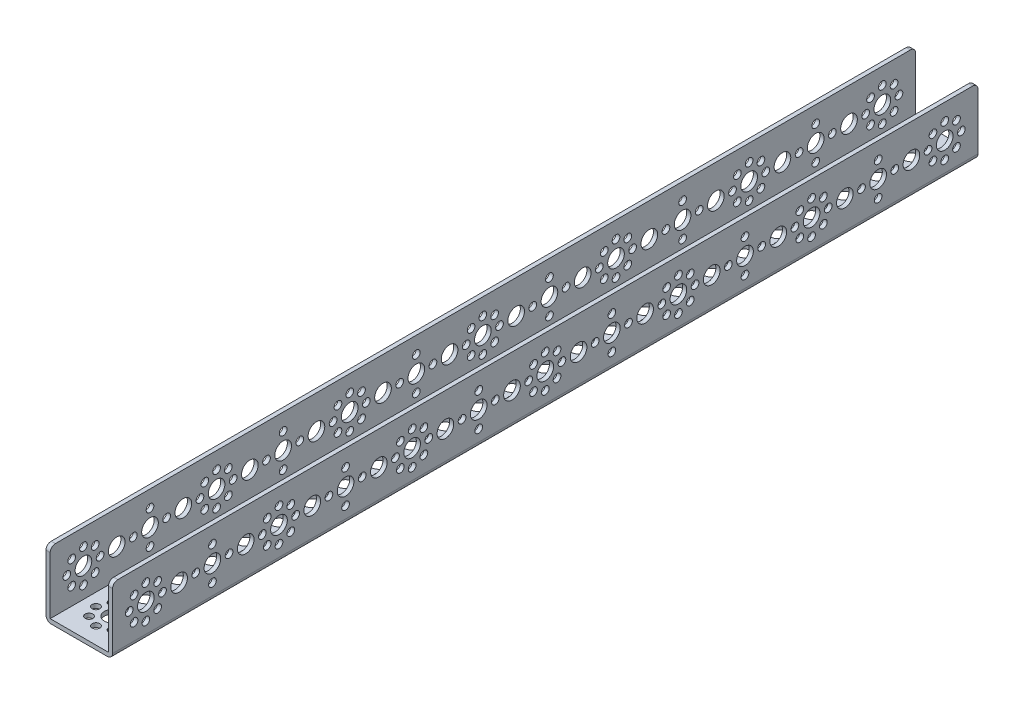
from build123d import *

# Parameters (mm, degrees)
SKETCH1_W                      = 32
SKETCH1_H                      = 416
BOSS_EXTRUDE1_DEPTH            = 32
SKETCH2_W                      = 28
SKETCH2_H                      = 30
CUT_EXTRUDE1_DEPTH             = 418.535627222
F_8_0_8_DIAMETER_HOLE1_D       = 8
F_8_0_8_DIAMETER_HOLE1_DEPTH   = 2
F_8_0_8_DIAMETER_HOLE2_D       = 8
F_8_0_8_DIAMETER_HOLE2_DEPTH   = 2
F_3_7_3_7_DIAMETER_HOLE1_D     = 3.7
F_3_7_3_7_DIAMETER_HOLE1_DEPTH = 2
F_3_7_3_7_DIAMETER_HOLE2_D     = 3.7
F_3_7_3_7_DIAMETER_HOLE2_DEPTH = 32
F_8_0_8_DIAMETER_HOLE3_D       = 8
F_8_0_8_DIAMETER_HOLE3_DEPTH   = 32
F_8_0_8_DIAMETER_HOLE4_D       = 8
F_8_0_8_DIAMETER_HOLE4_DEPTH   = 32
F_3_7_3_7_DIAMETER_HOLE3_D     = 3.7
F_3_7_3_7_DIAMETER_HOLE3_DEPTH = 32
FILLET1_R                      = 2.5


with BuildPart() as part:
    # Sketch1 → Boss-Extrude1 (new body)
    with BuildSketch(Plane(origin=(-16, 0, 0), x_dir=(0, -1, 0), z_dir=(-1, 0, 0))):
        with Locations((-16, -192)):
            Rectangle(SKETCH1_W, SKETCH1_H)
    extrude(amount=-BOSS_EXTRUDE1_DEPTH)

    # Sketch2 → Cut-Extrude1 (cut, through all)
    with BuildSketch(Plane.XY.offset(16)):
        with Locations((0, 17)):
            Rectangle(SKETCH2_W, SKETCH2_H)
    extrude(amount=-CUT_EXTRUDE1_DEPTH, mode=Mode.SUBTRACT)

    # Ø8.0 (8) Diameter Hole1
    with Locations(Plane.ZY.offset(-14)):
        with Locations((-32, 16)):
            Hole(F_8_0_8_DIAMETER_HOLE1_D / 2, depth=F_8_0_8_DIAMETER_HOLE1_DEPTH)

    # Ø8.0 (8) Diameter Hole2
    with Locations(Plane(origin=(16, 0, 0), x_dir=(0, 0, -1), z_dir=(1, 0, 0))):
        with Locations((64, 16), (128, 16), (192, 16), (256, 16), (320, 16), (384, 16), (96, 16), (160, 16), (224, 16), (288, 16), (352, 16), (16, 16), (48, 16), (80, 16), (112, 16), (144, 16), (176, 16), (208, 16), (240, 16), (0, 16), (272, 16), (304, 16), (336, 16), (368, 16)):
            Hole(F_8_0_8_DIAMETER_HOLE2_D / 2, depth=F_8_0_8_DIAMETER_HOLE2_DEPTH)

    # Ø3.7 (3.7) Diameter Hole1
    with Locations(Plane(origin=(16, 0, 0), x_dir=(0, 0, -1), z_dir=(1, 0, 0))):
        with Locations((0, 24), (0, 8), (8, 16), (-8, 16), (5.656854249, 21.656854249), (-5.656854249, 21.656854249), (-5.656854249, 10.343145751), (5.656854249, 10.343145751), (64, 24), (64, 8), (72, 16), (56, 16), (69.656854249, 21.656854249), (58.343145751, 21.656854249), (58.343145751, 10.343145751), (69.656854249, 10.343145751), (128, 24), (128, 8), (136, 16), (120, 16), (133.656854249, 21.656854249), (122.34314575, 21.656854249), (122.34314575, 10.343145751), (133.656854249, 10.343145751), (192, 24), (192, 8), (200, 16), (184, 16), (197.656854249, 21.656854249), (186.343145751, 21.656854249), (186.343145751, 10.343145751), (197.656854249, 10.343145751), (256, 24), (256, 8), (264, 16), (248, 16), (261.656854249, 21.656854249), (250.343145751, 21.656854249), (250.343145751, 10.343145751), (261.656854249, 10.343145751), (320, 24), (320, 8), (328, 16), (312, 16), (325.656854249, 21.656854249), (314.343145751, 21.656854249), (314.343145751, 10.343145751), (325.656854249, 10.343145751), (384, 24), (384, 8), (392, 16), (376, 16), (389.656854249, 21.656854249), (378.343145751, 21.656854249), (378.343145751, 10.343145751), (389.656854249, 10.343145751), (32, 24), (40, 16), (32, 8), (24, 16), (96, 24), (104, 16), (96, 8), (88, 16), (160, 24), (168, 16), (160, 8), (152, 16), (224, 24), (232, 16), (224, 8), (216, 16), (288, 24), (296, 16), (288, 8), (280, 16), (352, 24), (360, 16), (352, 8), (344, 16)):
            Hole(F_3_7_3_7_DIAMETER_HOLE1_D / 2, depth=F_3_7_3_7_DIAMETER_HOLE1_DEPTH)

    # Ø3.7 (3.7) Diameter Hole2
    with Locations(Plane(origin=(0, 0, 0), x_dir=(-1, 0, 0), z_dir=(0, -1, 0))):
        with Locations((8, 0), (5.656854249, 5.656854249), (0, 8), (-5.656854249, 5.656854249), (-8, 0), (-5.656854249, -5.656854249), (0, -8), (5.656854249, -5.656854249), (8, 64), (5.656854249, 69.656854249), (0, 72), (-5.656854249, 69.656854249), (-8, 64), (-5.656854249, 58.343145751), (0, 56), (5.656854249, 58.343145751), (8, 128), (5.656854249, 133.656854249), (0, 136), (-5.656854249, 133.656854249), (-8, 128), (-5.656854249, 122.34314575), (0, 120), (5.656854249, 122.34314575), (8, 192), (5.656854249, 197.656854249), (0, 200), (-5.656854249, 197.656854249), (-8, 192), (-5.656854249, 186.343145751), (0, 184), (5.656854249, 186.343145751), (8, 256), (5.656854249, 261.656854249), (0, 264), (-5.656854249, 261.656854249), (-8, 256), (-5.656854249, 250.343145751), (0, 248), (5.656854249, 250.343145751), (8, 320), (5.656854249, 325.656854249), (0, 328), (-5.656854249, 325.656854249), (-8, 320), (-5.656854249, 314.343145751), (0, 312), (5.656854249, 314.343145751), (8, 384), (5.656854249, 389.656854249), (0, 392), (-5.656854249, 389.656854249), (-8, 384), (-5.656854249, 378.343145751), (0, 376), (5.656854249, 378.343145751), (8, 32), (0, 40), (-8, 32), (0, 24), (8, 96), (0, 104), (-8, 96), (0, 88), (8, 160), (0, 168), (-8, 160), (0, 152), (8, 224), (0, 232), (-8, 224), (0, 216), (8, 288), (0, 296), (-8, 288), (0, 280), (8, 352), (0, 360), (-8, 352), (0, 344)):
            Hole(F_3_7_3_7_DIAMETER_HOLE2_D / 2, depth=F_3_7_3_7_DIAMETER_HOLE2_DEPTH)

    # Ø8.0 (8) Diameter Hole3
    with Locations(Plane(origin=(0, 0, 0), x_dir=(-1, 0, 0), z_dir=(0, -1, 0))):
        with Locations((0, 0), (0, 64), (0, 128), (0, 192), (0, 256), (0, 320), (0, 384), (0, 32), (0, 96), (0, 160), (0, 224), (0, 288), (0, 352), (0, 16), (0, 48), (0, 80), (0, 112), (0, 144), (0, 176), (0, 208), (0, 240), (0, 272), (0, 304), (0, 336), (0, 368)):
            Hole(F_8_0_8_DIAMETER_HOLE3_D / 2, depth=F_8_0_8_DIAMETER_HOLE3_DEPTH)

    # Ø8.0 (8) Diameter Hole4
    with Locations(Plane.ZY.offset(16)):
        with Locations((-64, 16), (-128, 16), (-192, 16), (-256, 16), (-320, 16), (-384, 16), (-32, 16), (-96, 16), (-160, 16), (-224, 16), (-288, 16), (-352, 16), (-16, 16), (-48, 16), (-80, 16), (-112, 16), (-144, 16), (-176, 16), (-208, 16), (-240, 16), (0, 16), (-272, 16), (-304, 16), (-336, 16), (-368, 16)):
            Hole(F_8_0_8_DIAMETER_HOLE4_D / 2, depth=F_8_0_8_DIAMETER_HOLE4_DEPTH)

    # Ø3.7 (3.7) Diameter Hole3
    with Locations(Plane.ZY.offset(16)):
        with Locations((0, 24), (0, 8), (-8, 16), (8, 16), (-5.656854249, 21.656854249), (5.656854249, 21.656854249), (5.656854249, 10.343145751), (-5.656854249, 10.343145751), (-64, 24), (-64, 8), (-72, 16), (-56, 16), (-69.656854249, 21.656854249), (-58.343145751, 21.656854249), (-58.343145751, 10.343145751), (-69.656854249, 10.343145751), (-128, 24), (-128, 8), (-136, 16), (-120, 16), (-133.656854249, 21.656854249), (-122.34314575, 21.656854249), (-122.34314575, 10.343145751), (-133.656854249, 10.343145751), (-192, 24), (-192, 8), (-200, 16), (-184, 16), (-197.656854249, 21.656854249), (-186.343145751, 21.656854249), (-186.343145751, 10.343145751), (-197.656854249, 10.343145751), (-256, 24), (-256, 8), (-264, 16), (-248, 16), (-261.656854249, 21.656854249), (-250.343145751, 21.656854249), (-250.343145751, 10.343145751), (-261.656854249, 10.343145751), (-320, 24), (-320, 8), (-328, 16), (-312, 16), (-325.656854249, 21.656854249), (-314.343145751, 21.656854249), (-314.343145751, 10.343145751), (-325.656854249, 10.343145751), (-384, 24), (-384, 8), (-392, 16), (-376, 16), (-389.656854249, 21.656854249), (-378.343145751, 21.656854249), (-378.343145751, 10.343145751), (-389.656854249, 10.343145751), (-32, 24), (-40, 16), (-32, 8), (-24, 16), (-96, 24), (-104, 16), (-96, 8), (-88, 16), (-160, 24), (-168, 16), (-160, 8), (-152, 16), (-224, 24), (-232, 16), (-224, 8), (-216, 16), (-288, 24), (-296, 16), (-288, 8), (-280, 16), (-352, 24), (-360, 16), (-352, 8), (-344, 16)):
            Hole(F_3_7_3_7_DIAMETER_HOLE3_D / 2, depth=F_3_7_3_7_DIAMETER_HOLE3_DEPTH)

    # Fillet1
    fillet1_edges = [part.edges().sort_by_distance(p)[0] for p in [
        (16, 0, -192),
        (15, 32, -400),
        (15, 32, 16),
        (-15, 32, 16),
        (-15, 32, -400),
        (-16, 0, -192),
    ]]
    fillet(fillet1_edges, radius=FILLET1_R)


solid = part.part
